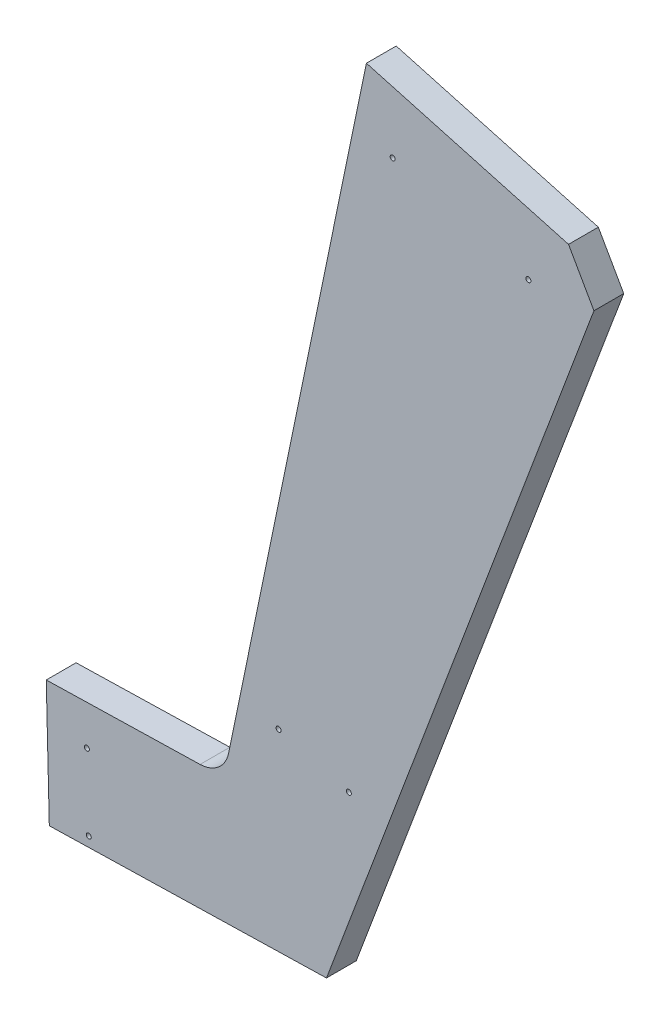
from build123d import *

# Parameters (mm, degrees)
BOSS_EXTRUDE1_DEPTH = 19.05
HOLE3_D             = 3.175
HOLE3_DEPTH         = 38.1
HOLE3_CSINK_D       = 10.16
HOLE3_CSINK_ANGLE   = 82
HOLE3_TIP           = 0.953866233


with BuildPart() as part:
    # Sketch1 → Boss-Extrude1 (new body)
    with BuildSketch(Plane.XY):
        with BuildLine():
            Line((-61.753066592, -505.133747826), (-59.805322331, -584.903623222))
            Line((-59.805322331, -584.903623222), (117.387139244, -580.57710775))
            Line((117.387139244, -580.57710775), (288.394610743, -125.650072018))
            Line((288.394610743, -125.650072018), (272.141590142, -96.993017293))
            Line((272.141590142, -96.993017293), (142.933900932, -61.306223753))
            Line((142.933900932, -61.306223753), (54.780700044, -487.546357698))
            ThreePointArc((54.780700044, -487.546357698), (48.334106484, -498.311851218), (36.590496304, -502.732489089))
            Line((36.590496304, -502.732489089), (-61.753066592, -505.133747826))
        make_face()
    extrude(amount=BOSS_EXTRUDE1_DEPTH)

    # Hole3
    with Locations(Plane(origin=(295.820901284, -105.894091108, -19.05), x_dir=(-0.3518626346959965, -0.9360516472421764, 8.51430303154421e-15), z_dir=(0, 0, -1))):
        with Locations((47.413288654, 127.596711745), (39.315467427, 37.945520226), (403.288916316, 71.764018496), (399.091743996, 25.297013484), (513.561319184, 161.164706775), (558.106616554, 143.167238399), (571.189751829, 175.54913452), (654.969392627, 382.911022042), (526.644454459, 193.546602895), (610.424095257, 400.908490418)):
            CounterSinkHole(HOLE3_D / 2, HOLE3_CSINK_D / 2, depth=HOLE3_DEPTH, counter_sink_angle=HOLE3_CSINK_ANGLE)
            with Locations((0, 0, -(HOLE3_DEPTH + HOLE3_TIP / 2))):  # 118° drill point
                Cone(0, HOLE3_D / 2, HOLE3_TIP, mode=Mode.SUBTRACT)


solid = part.part
